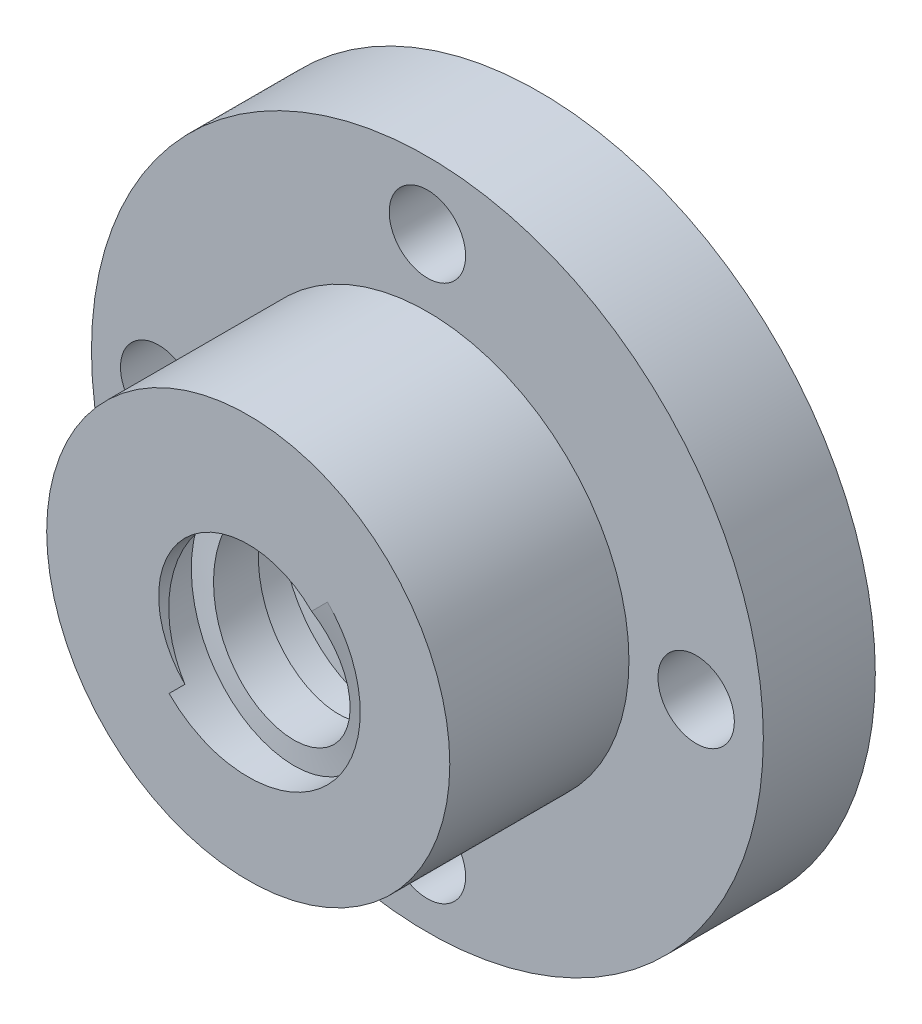
from build123d import *

# Parameters (mm, degrees)
SKETCH1_R           = 15
SKETCH1_R_2         = 4
BOSS_EXTRUDE1_DEPTH = 5
SKETCH2_R           = 9
SKETCH2_R_2         = 4
BOSS_EXTRUDE2_DEPTH = 8
CUT_SWEEP1_PITCH    = 4
SKETCH5_R           = 1.705132629
CUT_EXTRUDE1_DEPTH  = 8


with BuildPart() as part:
    # Sketch1 → Boss-Extrude1 (new body)
    with BuildSketch(Plane.XY):
        Circle(SKETCH1_R)
        Circle(SKETCH1_R_2, mode=Mode.SUBTRACT)
    extrude(amount=BOSS_EXTRUDE1_DEPTH)

    # Sketch2 → Boss-Extrude2 (add)
    with BuildSketch(Plane.XY.offset(5)):
        Circle(SKETCH2_R)
        Circle(SKETCH2_R_2, mode=Mode.SUBTRACT)
    extrude(amount=BOSS_EXTRUDE2_DEPTH)

    # Cut-Sweep1: arcs per turn and ends read off the stored shape
    # Cut-Sweep1: the profile of Sketch4 screwed along a right-hand helix through 10 turns, 12 arcs to a turn; built about Z, then put on its axis
    cut_sweep1_z = Axis((0, 0, 0), (0, 0, 1))
    cut_sweep1_corners = [(3, 0, -1), (5, 0, -1), (5, 0, 1), (3, 0, 1)]
    with BuildLine(mode=Mode.PRIVATE) as cut_sweep1_profile:
        Line(cut_sweep1_corners[0], cut_sweep1_corners[1])
        Line(cut_sweep1_corners[1], cut_sweep1_corners[2])
        Line(cut_sweep1_corners[2], cut_sweep1_corners[3])
        Line(cut_sweep1_corners[3], cut_sweep1_corners[0])
    cut_sweep1_cap = Face(cut_sweep1_profile.wire())
    cut_sweep1_turn_angles = [0, 15, 30, 45, 60, 75, 90, 105, 120, 135, 150, 165, 180, 195, 210, 225, 240, 255, 270, 285, 300, 315, 330, 345, 360]
    cut_sweep1_turn_weights = [1, 0.9659258262890683, 1, 0.9659258262890683, 1, 0.9659258262890683, 1, 0.9659258262890683, 1, 0.9659258262890683, 1, 0.9659258262890683, 1, 0.9659258262890683, 1, 0.9659258262890683, 1, 0.9659258262890683, 1, 0.9659258262890683, 1, 0.9659258262890683, 1, 0.9659258262890683, 1]
    cut_sweep1_turn_rails = [Edge.make_bspline([Vector(p[0], p[1], 0).rotate(cut_sweep1_z, cut_sweep1_turn_angles[k]) / cut_sweep1_turn_weights[k] + Vector(0, 0, p[2] + CUT_SWEEP1_PITCH * cut_sweep1_turn_angles[k] / 360) for k in range(25)], [0, 0, 0, 1, 1, 2, 2, 3, 3, 4, 4, 5, 5, 6, 6, 7, 7, 8, 8, 9, 9, 10, 10, 11, 11, 12, 12, 12], 2, cut_sweep1_turn_weights) for p in cut_sweep1_corners]
    cut_sweep1_turn_sides = [Face.make_surface_from_curves(cut_sweep1_turn_rails[p[0]], cut_sweep1_turn_rails[p[1]]) for p in [(0, 1), (1, 2), (2, 3), (3, 0)]]
    cut_sweep1 = Plane(origin=(0, 0, -10), x_dir=(0.7071067811865512, 0.7071067811865438, 0), z_dir=(0, 0, 1)) * Solid(Shell([*[p.moved(Location((0, 0, CUT_SWEEP1_PITCH * i))) for i in range(10) for p in cut_sweep1_turn_sides], cut_sweep1_cap, cut_sweep1_cap.rotate(cut_sweep1_z, 3600).moved(Location((0, 0, CUT_SWEEP1_PITCH * 3600 / 360)))]))
    add(cut_sweep1, mode=Mode.SUBTRACT)

    # Sketch5 → Cut-Extrude1 (cut)
    with BuildSketch(Plane.XY.offset(5)):
        with Locations((0, 12)):
            Circle(SKETCH5_R)
        with Locations((12, 0)):
            Circle(SKETCH5_R)
        with Locations((0, -12)):
            Circle(SKETCH5_R)
        with Locations((-12, 0)):
            Circle(SKETCH5_R)
    extrude(amount=-CUT_EXTRUDE1_DEPTH, mode=Mode.SUBTRACT)


solid = part.part
